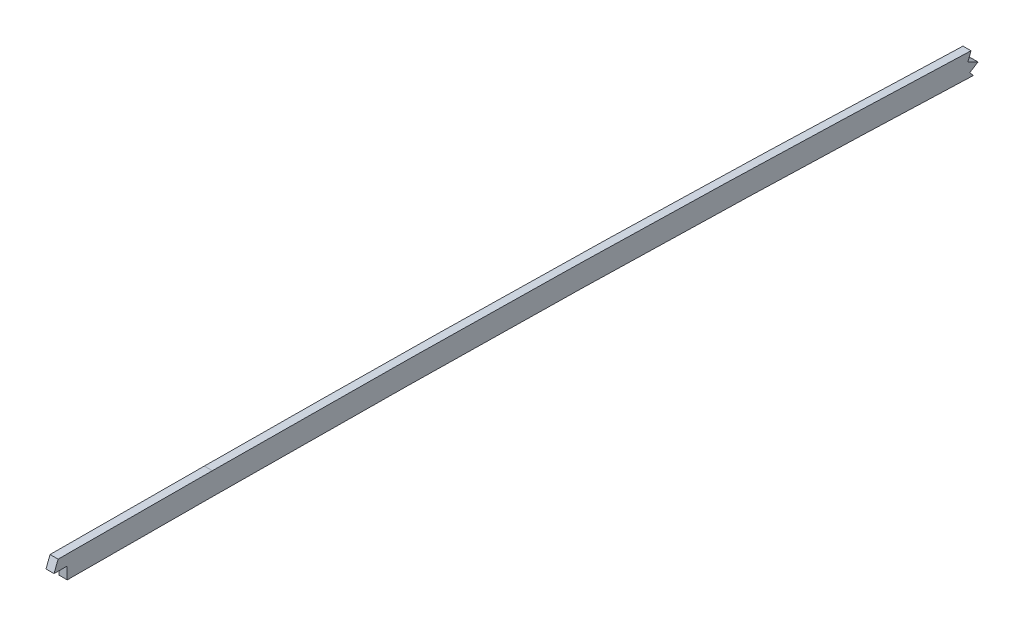
from build123d import *

# Parameters (mm, degrees)
BOSS_EXTRUDE1_START = -1.5875
BOSS_EXTRUDE1_DEPTH = 3.175
FILLET1_R           = 2.54
CUT_EXTRUDE1_DEPTH  = 2674.191025632
FILLET2_R           = 0.762
FILLET3_R           = 0.762
CUT_EXTRUDE2_DEPTH  = 7.62


with BuildPart() as part:
    # Boss-Extrude1: read off the stored shape, not the designer's step
    # Boss-Extrude1 outline → Boss-Extrude1 (new body)
    with BuildSketch(Plane(origin=(0, 0, 0), x_dir=(0, 0, -1), z_dir=(1, 0, 0)).offset(BOSS_EXTRUDE1_START)):
        with BuildLine():
            add(Edge.make_bspline(
                [(1110.404970926, 130.384545774), (1120.170834465, 130.370061323), (1139.703057908, 130.338772026), (1168.998370974, 130.277673039), (1198.290610395, 130.194386876), (1217.81419633, 130.113940836), (1227.576506903, 130.06508052)],
                knots=[0, 0, 0, 0, 0.25, 0.5, 0.75, 1, 1, 1, 1], degree=3))
            add(Edge.make_bspline(
                [(1227.576506903, 130.06508052), (1269.911205773, 129.853195249), (1333.427746701, 129.273373321), (1418.042208161, 127.449050563), (1502.665994832, 124.913583682), (1608.454176987, 120.803299479), (1693.070073331, 116.848243245), (1735.369787733, 114.744712179)],
                knots=[0, 0, 0, 0, 0.25, 0.375, 0.5, 0.75, 1, 1, 1, 1], degree=3))
            add(Edge.make_bspline(
                [(1735.369787733, 114.744712179), (1815.995940723, 110.735232018), (1936.906650462, 104.096364548), (2098.049485168, 94.18797875), (2198.694736725, 87.314638509), (2279.130413747, 81.114418931), (2339.412950304, 76.034076608), (2399.564054334, 70.28270545), (2479.570468264, 61.127378254), (2559.292087872, 49.650907614), (2626.797554585, 38.235484735), (2656.889518578, 32.788503969), (2667.159793662, 30.877771266), (2669.54, 30.432069924)],
                knots=[0, 0, 0, 0, 0.25, 0.375, 0.5, 0.5625, 0.625, 0.6875, 0.75, 0.875, 0.9375, 0.96241067, 0.969928536, 0.969928536, 0.969928536, 0.969928536], degree=3))
            Line((2669.54, 30.432069924), (2669.54, 39.476142465))
            add(Edge.make_bspline(
                [(1735.811334709, 123.623740069), (1776.138635499, 121.618292624), (1816.460281579, 119.500621806), (1897.093668675, 115.087561885), (1937.405638896, 112.792971084), (2018.018419045, 108.018366523), (2058.319512223, 105.539122976), (2138.903780144, 100.307240032), (2179.18739793, 97.555127955), (2239.586998714, 93.080168687), (2259.716280977, 91.529837622), (2289.900442602, 89.09084343), (2299.960179135, 88.258845039), (2320.076004566, 86.552861654), (2330.132100898, 85.678962223), (2350.239356518, 83.874334847), (2360.290489794, 82.943307484), (2380.385973971, 81.003183297), (2390.430065378, 79.993418555), (2420.547026195, 76.827577532), (2440.60648589, 74.533672955), (2480.675569568, 69.556278523), (2500.68715183, 66.874150811), (2540.654290207, 61.150246295), (2560.611026428, 58.109755646), (2600.475457131, 51.702465574), (2620.382967089, 48.337538888), (2650.028116889, 43.072156367), (2659.78844051, 41.29687683), (2669.54, 39.476142465)],
                knots=[0, 0, 0, 0, 0.125, 0.125, 0.25, 0.25, 0.375, 0.375, 0.5, 0.5, 0.5625, 0.5625, 0.59375, 0.59375, 0.625, 0.625, 0.65625, 0.65625, 0.6875, 0.6875, 0.75, 0.75, 0.8125, 0.8125, 0.875, 0.875, 0.9375, 0.9375, 0.968210768, 0.968210768, 0.968210768, 0.968210768], degree=3))
            add(Edge.make_bspline(
                [(1227.621000751, 138.954969175), (1248.807303679, 138.848931677), (1269.993583155, 138.701170252), (1312.363832348, 138.270664618), (1333.547719008, 137.987407832), (1375.912368189, 137.249274813), (1397.09309738, 136.7925677), (1439.451328259, 135.701855835), (1460.629010312, 135.069210584), (1502.979101161, 133.670541385), (1524.152152736, 132.907434339), (1566.494303759, 131.284732459), (1587.663166024, 130.423163385), (1651.164052809, 127.709123983), (1693.490421561, 125.728325331), (1735.811334709, 123.623740069)],
                knots=[0, 0, 0, 0, 0.125, 0.125, 0.25, 0.25, 0.375, 0.375, 0.5, 0.5, 0.625, 0.625, 0.75, 0.75, 1, 1, 1, 1], degree=3))
            add(Edge.make_bspline(
                [(1110.418156307, 139.274535996), (1129.952027249, 139.245563914), (1149.485893504, 139.211997476), (1188.553558893, 139.115899087), (1208.087346834, 139.052735015), (1227.621000751, 138.954969175)],
                knots=[0, 0, 0, 0, 0.5, 0.5, 1, 1, 1, 1], degree=3))
            add(Edge.make_bspline(
                [(768.740124165, 138.468408213), (782.976796045, 138.460280143), (797.213453801, 138.479500079), (825.686695051, 138.549690296), (839.923258916, 138.600062665), (868.396318956, 138.719026333), (882.632808962, 138.789607972), (911.105746117, 138.939594729), (925.342197007, 139.018479563), (953.81517223, 139.160090703), (968.051699178, 139.222241505), (996.524919377, 139.30995407), (1010.761605517, 139.335014039), (1039.234912871, 139.349647552), (1053.471562869, 139.340493535), (1081.944860968, 139.313691902), (1096.181508981, 139.29565137), (1110.418156307, 139.274535996)],
                knots=[0, 0, 0, 0, 0.125, 0.125, 0.25, 0.25, 0.375, 0.375, 0.5, 0.5, 0.625, 0.625, 0.75, 0.75, 0.875, 0.875, 1, 1, 1, 1], degree=3))
            add(Edge.make_bspline(
                [(630.778432202, 139.251437536), (653.771819614, 139.075315664), (676.765000849, 138.871740519), (711.255349111, 138.647690701), (722.752238945, 138.586174182), (745.746099074, 138.499784896), (757.243084259, 138.474972158), (768.740124165, 138.468408213)],
                knots=[0, 0, 0, 0, 0.5, 0.5, 0.75, 0.75, 1, 1, 1, 1], degree=3))
            add(Edge.make_bspline(
                [(604.514984259, 139.433685568), (609.940743136, 139.400696354), (618.695242427, 139.342071397), (627.449694696, 139.276935028), (630.778432202, 139.251437536)],
                knots=[0, 0, 0, 0, 0.619765686, 1, 1, 1, 1], degree=3))
            ThreePointArc((604.514984259, 139.433685568), (600.549356142, 139.457173081), (596.583720644, 139.479379304))
            add(Edge.make_bspline(
                [(436.133018826, 139.357176562), (449.50393779, 139.390650739), (462.874888934, 139.412366015), (489.61665939, 139.498555977), (502.987497127, 139.559076553), (529.729299233, 139.628029754), (543.100240501, 139.639230481), (569.84212102, 139.601013959), (583.212960696, 139.552035302), (596.583720644, 139.479379304)],
                knots=[0, 0, 0, 0, 0.25, 0.25, 0.5, 0.5, 0.75, 0.75, 1, 1, 1, 1], degree=3))
            add(Edge.make_bspline(
                [(432.263917423, 139.347117104), (433.553617637, 139.350567112), (434.843318039, 139.353947814), (436.133018826, 139.357176562)],
                knots=[0, 0, 0, 0, 1, 1, 1, 1], degree=3))
            add(Edge.make_bspline(
                [(420.316232014, 139.305761868), (422.413235913, 139.315186344), (426.395793967, 139.330351666), (430.378363115, 139.342073082), (432.263917423, 139.347117104)],
                knots=[0, 0, 0, 0, 0.526548575, 1, 1, 1, 1], degree=3))
            add(Edge.make_bspline(
                [(376.410119779, 138.75403864), (383.726317086, 138.935561778), (391.043801196, 139.055611797), (405.679602634, 139.224192856), (412.997895507, 139.272871444), (420.316232014, 139.305761868)],
                knots=[0, 0, 0, 0, 0.5, 0.5, 1, 1, 1, 1], degree=3))
            add(Edge.make_bspline(
                [(336.49221538, 137.002990798), (349.782924989, 137.88646357), (363.094318653, 138.423658969), (376.410119779, 138.75403864)],
                knots=[0, 0, 0, 0, 1, 1, 1, 1], degree=3))
            add(Edge.make_bspline(
                [(322.369488076, 135.928469458), (327.073374868, 136.333386449), (331.781331813, 136.689844531), (336.49221538, 137.002990798)],
                knots=[0, 0, 0, 0, 1, 1, 1, 1], degree=3))
            add(Edge.make_bspline(
                [(269.769949315, 129.47895505), (274.123387467, 130.231879276), (278.485668028, 130.925946417), (287.22796256, 132.196043087), (291.608626646, 132.771988738), (300.381777496, 133.818422146), (304.774579419, 134.288963443), (313.567800313, 135.154375086), (317.967903853, 135.549407043), (322.369488076, 135.928469458)],
                knots=[0, 0, 0, 0, 0.25, 0.25, 0.5, 0.5, 0.75, 0.75, 1, 1, 1, 1], degree=3))
            add(Edge.make_bspline(
                [(135.15718457, 90.054634926), (146.043739673, 94.375230064), (156.99891695, 98.504335222), (173.56622243, 104.322560697), (179.110932848, 106.199810145), (190.24859245, 109.819698901), (195.841545849, 111.562316625), (207.065472514, 114.901345648), (212.697969124, 116.49836249), (224.005973618, 119.540534541), (229.683240596, 120.9862349), (246.767187276, 125.077694043), (258.225188059, 127.482295924), (269.769949315, 129.47895505)],
                knots=[0, 0, 0, 0, 0.25, 0.25, 0.375, 0.375, 0.5, 0.5, 0.625, 0.625, 0.75, 0.75, 1, 1, 1, 1], degree=3))
            add(Edge.make_bspline(
                [(107.049744533, 78.466050261), (116.373258882, 82.438606419), (125.737350123, 86.316143859), (135.15718457, 90.054634926)],
                knots=[0, 0, 0, 0, 1, 1, 1, 1], degree=3))
            add(Edge.make_bspline(
                [(99.06, 75.03568963), (99.223542669, 75.106424562), (100.635498802, 75.716852689), (103.297453866, 76.863328103), (105.798503999, 77.932922637), (107.049744533, 78.466050261)],
                knots=[0.484151133, 0.484151133, 0.484151133, 0.484151133, 0.515864471, 0.757931449, 1, 1, 1, 1], degree=3))
            Line((99.06, 75.03568963), (99.06, 65.345043949))
            add(Edge.make_bspline(
                [(99.06, 65.345043949), (99.380370965, 65.484464523), (100.637671455, 66.031176319), (103.17753745, 67.132002814), (106.681577323, 68.64166857), (109.249580285, 69.740028797), (110.534459652, 70.287489229)],
                knots=[0.254738807, 0.254738807, 0.254738807, 0.254738807, 0.317238807, 0.5, 0.75, 1, 1, 1, 1], degree=3))
            add(Edge.make_bspline(
                [(110.534459652, 70.287489229), (112.850658013, 71.274373329), (117.489277519, 73.236837099), (124.456688526, 76.138068453), (131.438476528, 78.994265342), (136.101204469, 80.864754132), (138.436571012, 81.791601309)],
                knots=[0, 0, 0, 0, 0.25, 0.5, 0.75, 1, 1, 1, 1], degree=3))
            add(Edge.make_bspline(
                [(138.436571012, 81.791601309), (143.826897197, 83.930883835), (154.6522834, 88.11877139), (176.408203186, 96.037596764), (203.906835742, 104.998187521), (237.39469787, 114.027149543), (259.934818065, 118.755998441), (271.284977744, 120.719001348)],
                knots=[0, 0, 0, 0, 0.125, 0.25, 0.5, 0.75, 1, 1, 1, 1], degree=3))
            add(Edge.make_bspline(
                [(271.284977744, 120.719001348), (275.558711595, 121.458140765), (284.124297478, 122.821139095), (297.036360548, 124.518896272), (310.018420247, 125.909880891), (318.766623126, 126.695286194), (323.13209925, 127.071239405)],
                knots=[5e-09, 5e-09, 5e-09, 5e-09, 0.2499992, 0.4999984, 0.7499976, 0.999996801, 0.999996801, 0.999996801, 0.999996801], degree=3))
            add(Edge.make_bspline(
                [(323.13209925, 127.071239405), (324.293050056, 127.171175344), (326.615168427, 127.365043892), (330.101568176, 127.638529754), (333.590184216, 127.895089457), (335.917953069, 128.055198639), (337.081858513, 128.132566852)],
                knots=[1.2024e-05, 1.2024e-05, 1.2024e-05, 1.2024e-05, 0.250009018, 0.500006012, 0.750003006, 1, 1, 1, 1], degree=3))
            add(Edge.make_bspline(
                [(337.081858513, 128.132566852), (340.367862287, 128.350997241), (346.939906877, 128.744909116), (356.821319657, 129.221190111), (366.716250393, 129.595096292), (373.326613137, 129.784797569), (376.630622597, 129.866773678)],
                knots=[0, 0, 0, 0, 0.25, 0.5, 0.75, 1, 1, 1, 1], degree=3))
            add(Edge.make_bspline(
                [(376.630622597, 129.866773678), (380.266394474, 129.956981294), (387.534764147, 130.106779908), (398.462206547, 130.259361028), (409.400972015, 130.358727994), (416.705417778, 130.39944419), (420.356185481, 130.415851648)],
                knots=[0, 0, 0, 0, 0.25, 0.5, 0.75, 1, 1, 1, 1], degree=3))
            add(Edge.make_bspline(
                [(420.356185481, 130.415851648), (421.350045129, 130.420318309), (423.337533562, 130.428603137), (426.320174328, 130.439402209), (429.303468332, 130.448883952), (431.293011648, 130.454488038), (432.287698861, 130.457148912)],
                knots=[0, 0, 0, 0, 0.25, 0.5, 0.75, 1, 1, 1, 1], degree=3))
            add(Edge.make_bspline(
                [(432.287698861, 130.457148912), (432.610032304, 130.45801117), (433.254717136, 130.45972707), (434.221637716, 130.462266911), (435.188505114, 130.464765142), (435.833012253, 130.466397641), (436.155274747, 130.46720442)],
                knots=[9.2e-08, 9.2e-08, 9.2e-08, 9.2e-08, 0.25, 0.5, 0.75, 1, 1, 1, 1], degree=3))
            add(Edge.make_bspline(
                [(436.155274747, 130.46720442), (449.528322363, 130.500683927), (476.275740382, 130.546633815), (516.38896029, 130.728798697), (556.456290895, 130.759667498), (583.176533448, 130.662101975), (596.535396133, 130.589510646)],
                knots=[0, 0, 0, 0, 0.249999973, 0.499999946, 0.749999918, 0.999999891, 0.999999891, 0.999999891, 0.999999891], degree=3))
            ThreePointArc((596.535396133, 130.589510646), (600.498158983, 130.567320504), (604.460914457, 130.543849998))
            add(Edge.make_bspline(
                [(604.460914457, 130.543849998), (606.648150431, 130.530551362), (611.022503017, 130.502867011), (617.584689429, 130.458405465), (624.147187284, 130.411339888), (628.522663802, 130.378455494), (630.7103385, 130.361698324)],
                knots=[-7.09e-07, -7.09e-07, -7.09e-07, -7.09e-07, 0.249999468, 0.499999646, 0.749999823, 1, 1, 1, 1], degree=3))
            add(Edge.make_bspline(
                [(630.7103385, 130.361698324), (642.206126489, 130.273644326), (665.193556095, 130.083785311), (699.699077953, 129.819212193), (734.21504011, 129.634735151), (757.228597075, 129.58497898), (768.735048644, 129.578409662)],
                knots=[0, 0, 0, 0, 0.25, 0.5, 0.75, 1, 1, 1, 1], degree=3))
            add(Edge.make_bspline(
                [(768.735048644, 129.578409662), (797.222409768, 129.56214552), (854.203652026, 129.725124503), (939.635195481, 130.236578518), (1024.992958464, 130.524931921), (1081.937612336, 130.426767717), (1110.404970926, 130.384545774)],
                knots=[0, 0, 0, 0, 0.25, 0.5, 0.75, 1, 1, 1, 1], degree=3))
        make_face()
    extrude(amount=BOSS_EXTRUDE1_DEPTH)

    # Fillet1
    fillet1_edges = [part.edges().sort_by_distance(p)[0] for p in [
        (0, 39.476142465, -2669.54),
        (0, 30.432069924, -2669.54),
        (0, 65.345043949, -99.06),
        (0, 75.03568963, -99.06),
    ]]
    fillet(fillet1_edges, radius=FILLET1_R)

    # Sketch4 → Cut-Extrude1 (cut, through all)
    with BuildSketch(Plane(origin=(1.5875, 0, 0), x_dir=(0, 0, -1), z_dir=(1, 0, 0))):
        Polygon((1827.2125, 118.895836595), (1827.2125, 110.000384115), (1827.2125, 78.791710134), (2135.1875, 78.791710134), (2135.1875, 91.599357392), (2135.1875, 100.508307819), (2135.1875, 129.353842083), (1827.2125, 129.353842083), align=None)
    extrude(amount=-CUT_EXTRUDE1_DEPTH, mode=Mode.SUBTRACT)


with BuildPart() as cut_extrude1_piece_1:
    # of the separate pieces the step leaves, piece 1, a body of its own (cut_extrude1_pieces)
    add(part.part.solids().sort_by_distance((-1.5875, 114.744712179, -1735.369787733))[0])

    # Fillet2
    fillet2_edges = [cut_extrude1_piece_1.edges().sort_by_distance(p)[0] for p in [
        (0, 118.895836595, -1827.2125),
        (0, 110.000384116, -1827.2125),
    ]]
    fillet(fillet2_edges, radius=FILLET2_R)


with BuildPart() as cut_extrude1_piece_2:
    # of the separate pieces the step leaves, piece 2, a body of its own (cut_extrude1_pieces)
    add(part.part.solids().sort_by_distance((-1.5875, 91.599357392, -2135.1875))[0])

    # Fillet3
    fillet3_edges = [cut_extrude1_piece_2.edges().sort_by_distance(p)[0] for p in [
        (0, 100.508307819, -2135.1875),
        (0, 91.599357392, -2135.1875),
    ]]
    fillet(fillet3_edges, radius=FILLET3_R)


with BuildPart() as cut_extrude2_tool:
    # Sketch5 → Cut-Extrude2 (new body)
    with BuildSketch(Plane(origin=(1.5875, 0, 0), x_dir=(0, 0, -1), z_dir=(1, 0, 0))):
        Polygon((1526.921002642, 132.788776067), (1525.689431031, 129.632745348), (1529.671392187, 127.575945218), (1526.428351657, 125.564439067), (1528.398437884, 123.245298517), (1528.398437884, 114.766362614), (2693.334534373, -50.097096662), (2835.169185114, 79.330013005), (1526.921002642, 139.169420645), align=None)
        Polygon((1166.769177473, 139.169420645), (1166.769177473, 145.055582544), (49.799388011, 171.247154198), (49.799388011, 0), (1170.386904229, 114.766362614), (1170.386904229, 130.270526743), (1170.386904229, 135.018963115), (1165.186656638, 135.018963115), align=None)
    extrude(amount=-CUT_EXTRUDE2_DEPTH)


with BuildPart() as cut_extrude1_piece_1_1:
    add(cut_extrude1_piece_1.part)

    # Cut-Extrude2: cut by cut_extrude2_tool
    add(cut_extrude2_tool.part, mode=Mode.SUBTRACT)


with BuildPart() as cut_extrude1_piece_2_1:
    add(cut_extrude1_piece_2.part)

    # Cut-Extrude2: cut by cut_extrude2_tool
    add(cut_extrude2_tool.part, mode=Mode.SUBTRACT)


solid = cut_extrude1_piece_1_1.part
